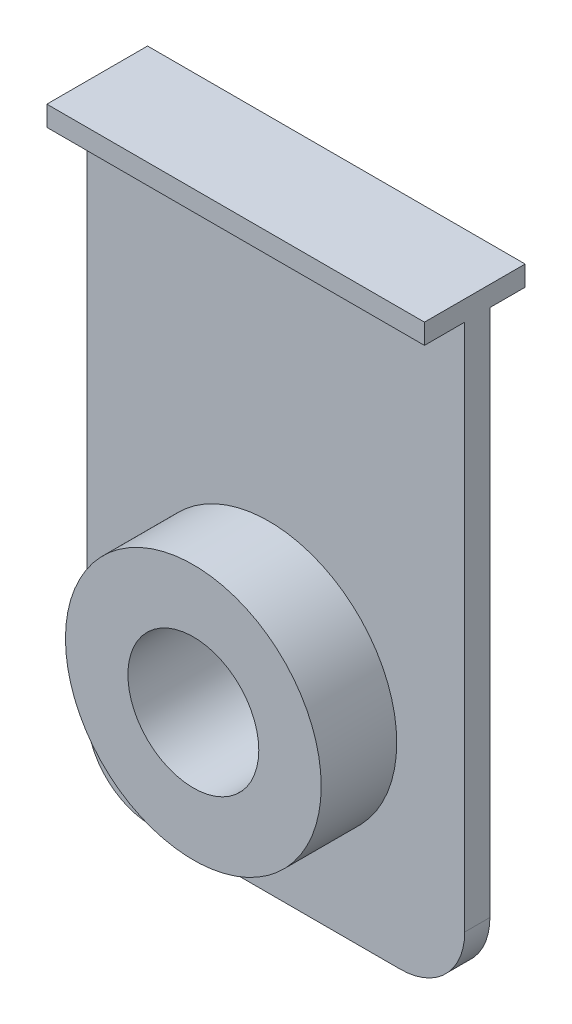
from build123d import *

# Parameters (mm, degrees)
SKETCH12_W                = 75
SKETCH12_H                = 121.71
BOSS_EXTRUDE10_DEPTH      = 5
SKETCH15_R                = 25.4
BOSS_EXTRUDE11_DEPTH      = 15
SKETCH23_R                = 13
CUT_EXTRUDE7_DEPTH        = 185.436500357
BOSS_EXTRUDE13_DEPTH      = 8
BOSS_EXTRUDE13_DEPTH_BACK = 12
SKETCH24_W                = 75
SKETCH24_H                = 4
FILLET2_R                 = 12.8


with BuildPart() as part:
    # Sketch12 → Boss-Extrude10 (new body)
    with BuildSketch(Plane.XY):
        with Locations((99.625849364, 60.855)):
            Rectangle(SKETCH12_W, SKETCH12_H)
    extrude(amount=BOSS_EXTRUDE10_DEPTH)

    # Sketch15 → Boss-Extrude11 (add)
    with BuildSketch(Plane.XY.offset(5)):
        with Locations((98.219620603, 38.627603634)):
            Circle(SKETCH15_R)
    extrude(amount=BOSS_EXTRUDE11_DEPTH)

    # Sketch23 → Cut-Extrude7 (cut, through all)
    with BuildSketch(Plane.XY.offset(20)):
        with Locations((98.219620603, 38.627603634)):
            Circle(SKETCH23_R)
    extrude(amount=-CUT_EXTRUDE7_DEPTH, mode=Mode.SUBTRACT)

    # Sketch24 → Boss-Extrude13 (add, two sides: drawn at the far end of the back side and taken through both)
    with BuildSketch(Plane.XY.offset(5).offset(-BOSS_EXTRUDE13_DEPTH_BACK)):
        with Locations((99.625849364, 119.71)):
            Rectangle(SKETCH24_W, SKETCH24_H)
    extrude(amount=BOSS_EXTRUDE13_DEPTH + BOSS_EXTRUDE13_DEPTH_BACK)

    # Fillet2
    fillet2_edges = [part.edges().sort_by_distance(p)[0] for p in [
        (137.125849364, 0, 2.5),
        (62.125849364, 0, 2.5),
    ]]
    fillet(fillet2_edges, radius=FILLET2_R)


solid = part.part
